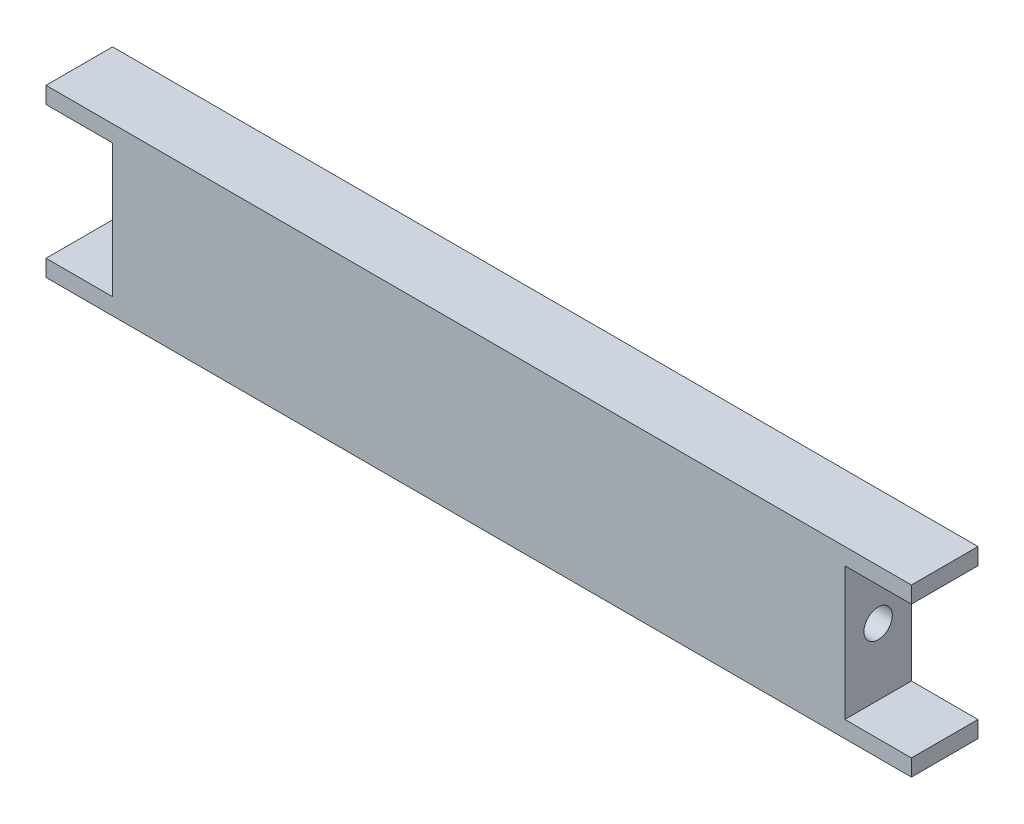
from build123d import *

# Parameters (mm, degrees)
BOSS_EXTRUDE1_DEPTH = 6.35


with BuildPart() as part:
    # Sketch1 → Boss-Extrude1 (new body)
    with BuildSketch(Plane.XY):
        Polygon((-41.275, -7.9375), (41.275, -7.9375), (41.275, -6.35), (34.925, -6.35), (34.925, 6.35), (41.275, 6.35), (41.275, 7.9375), (-41.275, 7.9375), (-41.275, 6.35), (-34.925, 6.35), (-34.925, -6.35), (-41.275, -6.35), align=None)
    extrude(amount=BOSS_EXTRUDE1_DEPTH)

    # Sketch4 → Tap Drill for #6-32 Tap1 (revolve, cut)
    with BuildSketch(Plane(origin=(34.925, 0, 3.175), x_dir=(0, 0, -1), z_dir=(0, 1, 0))):
        Polygon((0, 0), (0, 7.16269403), (1.35255, 6.35), (1.35255, 0), align=None)
    tap_drill_for_6_32_tap1 = revolve(axis=Axis((41.275, 0, 3.175), (-1, 0, 0)), mode=Mode.SUBTRACT)

    # Mirror1: Tap Drill for #6-32 Tap1 across plane
    add(tap_drill_for_6_32_tap1.mirror(Plane.ZY), mode=Mode.SUBTRACT)


solid = part.part
